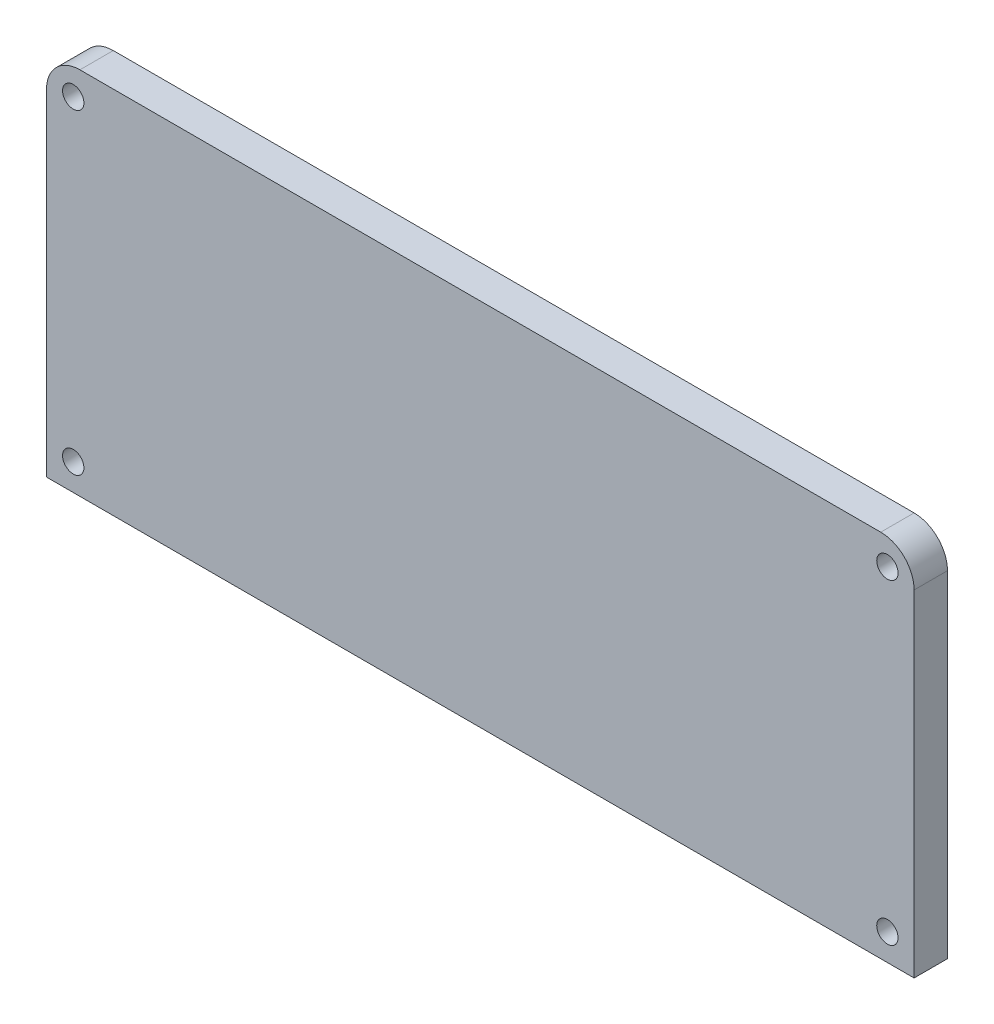
from build123d import *

# Parameters (mm, degrees)
BOSS_EXTRUDE1_DEPTH                                 = 130
SHELL1_T                                            = -5
SKETCH3_R                                           = 3.4
SKETCH3_W                                           = 73.1
SKETCH3_H                                           = 26.5
CUT_EXTRUDE1_DEPTH                                  = 5
FILLET1_R                                           = 10
FILLET2_R                                           = 5
CUT_EXTRUDE2_DEPTH                                  = 5
FILLET3_R                                           = 5
CUT_EXTRUDE3_REACH                                  = 191.36
SKETCH5_R                                           = 1.4
CUT_EXTRUDE4_REACH                                  = 191.36
SKETCH6_R                                           = 1.1
CUT_EXTRUDE5_REACH                                  = 185.945
SKETCH7_R                                           = 1.5
CSK_FOR_M3_COUNTERSUNK_FLAT_HEAD_SCREW2_D           = 3.2
CSK_FOR_M3_COUNTERSUNK_FLAT_HEAD_SCREW2_DEPTH       = 8
CSK_FOR_M3_COUNTERSUNK_FLAT_HEAD_SCREW2_CSINK_D     = 6.3
CSK_FOR_M3_COUNTERSUNK_FLAT_HEAD_SCREW2_CSINK_ANGLE = 90
CSK_FOR_M3_COUNTERSUNK_FLAT_HEAD_SCREW2_TIP         = 0.96137699
CUT_EXTRUDE6_REACH                                  = 187.376
SKETCH15_R                                          = 1.2
CUT_EXTRUDE7_DEPTH                                  = 20
SKETCH16_R                                          = 1.2
BOSS_EXTRUDE2_DEPTH                                 = 5
CSK_FOR_M3_COUNTERSUNK_FLAT_HEAD_SCR_2_COUNT        = 2
CSK_FOR_M3_COUNTERSUNK_FLAT_HEAD_SCR_2_PITCH        = 47.355339059
CSK_FOR_M3_COUNTERSUNK_FLAT_HEAD_SCR_3_COUNT        = 2
CSK_FOR_M3_COUNTERSUNK_FLAT_HEAD_SCR_3_PITCH        = 122
CSK_FOR_M3_COUNTERSUNK_FLAT_HEAD_SCR_4_COUNT        = 2
CSK_FOR_M3_COUNTERSUNK_FLAT_HEAD_SCR_4_PITCH        = 130.868361866


with BuildPart() as part:
    # Sketch2 → Boss-Extrude1 (new body)
    with BuildSketch(Plane(origin=(0, 0, 0), x_dir=(0, 0, -1), z_dir=(1, 0, 0))):
        Polygon((0, 0), (0, 20), (35.355339059, 55.355339059), (120, 55.355339059), (120, 0), align=None)
    extrude(amount=BOSS_EXTRUDE1_DEPTH)

    # Shell1
    shell1_openings = [part.faces().sort_by_distance(p)[0] for p in [
        (65, 27.67766953, -120),
    ]]
    offset(amount=SHELL1_T, openings=shell1_openings, kind=Kind.INTERSECTION)

    # Sketch3 → Cut-Extrude1 (cut)
    with BuildSketch(Plane(origin=(0, 10, 10), x_dir=(1, 0, 0), z_dir=(0, 0.7071067811865486, 0.7071067811865465))):
        with Locations(Location((108.1, 39.142135624, 0), (0, 0, 270))):
            Circle(SKETCH3_R)
        with Locations((53.55, 39.142135624)):
            Rectangle(SKETCH3_W, SKETCH3_H)
    extrude(amount=-CUT_EXTRUDE1_DEPTH, mode=Mode.SUBTRACT)

    # Fillet1
    # the kernel refuses this fillet: 10 mm, written as the material it adds along each edge
    with BuildSketch(Plane(origin=(125, 50.355339059, -37.426406871), x_dir=(0, 0, -1), z_dir=(-1, 0, 0)), Plane(origin=(125, 17.928932188, -5), x_dir=(0, 0.7071067811865465, -0.7071067811865486), z_dir=(-1, 0, 0))) as fillet1_piece_1:
        with BuildLine():
            CenterArc((FILLET1_R * 0.414213562373, FILLET1_R), FILLET1_R, 225, 45)
            Line((-FILLET1_R * 0.292893218813, FILLET1_R * 0.292893218813), (0, 0))
            Line((0, 0), (FILLET1_R * 0.414213562373, 0))
        make_face()
    extrude(amount=120)
    with BuildSketch(Plane(origin=(5, 5, -5), x_dir=(0, 0, -1), z_dir=(1, 0, 0))) as fillet1_piece_2:
        with BuildLine():
            CenterArc((FILLET1_R, FILLET1_R), FILLET1_R, 180, 90)
            Line((0, FILLET1_R), (0, 0))
            Line((0, 0), (FILLET1_R, 0))
        make_face()
    extrude(amount=120)
    # the kernel refuses this fillet: 10 mm, written as the material it takes off along each edge
    with BuildSketch(Plane(origin=(-10.355339059, 20, 0), x_dir=(0, -1, 0), z_dir=(1, 0, 0)), Plane(origin=(-10.355339059, 55.355339059, -35.355339059), x_dir=(0, -0.7071067811865476, 0.7071067811865476), z_dir=(1, 0, 0))) as fillet1_2_piece_1:
        with BuildLine():
            CenterArc((FILLET1_R * 0.414213562373, FILLET1_R), FILLET1_R, 225, 45)
            Line((-FILLET1_R * 0.292893218813, FILLET1_R * 0.292893218813), (0, 0))
            Line((0, 0), (FILLET1_R * 0.414213562373, 0))
        make_face()
    extrude(amount=150.710678119, mode=Mode.SUBTRACT)

    # Fillet2
    fillet2_edges = [part.edges().sort_by_distance(p)[0] for p in [
        (130, 55.355339059, -79.748737342),
        (0, 7.928932188, 0),
        (130, 7.928932188, 0),
        (0, 37.67766953, -17.67766953),
        (0, 54.594134384, -35.670640359),
        (0, 19.6846987, -0.761204675),
        (130, 37.67766953, -17.67766953),
        (130, 54.594134384, -35.670640359),
        (130, 19.6846987, -0.761204675),
        (0, 55.355339059, -79.748737342),
    ]]
    fillet(fillet2_edges, radius=FILLET2_R)

    # Sketch4 → Cut-Extrude2 (cut)
    with BuildSketch(Plane(origin=(130, 0, 0), x_dir=(0, 0, -1), z_dir=(1, 0, 0))):
        with BuildLine():
            Line((108, 22), (112, 22))
            ThreePointArc((112, 22), (113.414213562, 21.414213562), (114, 20))
            Line((114, 20), (114, 17))
            ThreePointArc((114, 17), (113.414213562, 15.585786438), (112, 15))
            Line((112, 15), (108, 15))
            ThreePointArc((108, 15), (106.585786438, 15.585786438), (106, 17))
            Line((106, 17), (106, 20))
            ThreePointArc((106, 20), (106.585786438, 21.414213562), (108, 22))
        make_face()
    extrude(amount=-CUT_EXTRUDE2_DEPTH, mode=Mode.SUBTRACT)

    # Fillet3
    # the kernel refuses this fillet: 5 mm, written as the material it adds along each edge
    with BuildSketch(Plane(origin=(5, 50.355339059, -120), x_dir=(1, 0, 0), z_dir=(0, 0, 1))) as fillet3_piece_1:
        with BuildLine():
            CenterArc((FILLET3_R, -FILLET3_R), FILLET3_R, 90, 90)
            Line((0, -FILLET3_R), (0, 0))
            Line((0, 0), (FILLET3_R, 0))
        make_face()
    fillet3_piece_1_solid = extrude(amount=78.431457505, mode=Mode.PRIVATE)
    with BuildSketch(Plane(origin=(125, 50.355339059, -120), x_dir=(-1, 0, 0), z_dir=(0, 0, 1))) as fillet3_piece_2:
        with BuildLine():
            CenterArc((FILLET3_R, FILLET3_R), FILLET3_R, 180, 90)
            Line((0, FILLET3_R), (0, 0))
            Line((0, 0), (FILLET3_R, 0))
        make_face()
    fillet3_piece_2_solid = extrude(amount=78.431457505, mode=Mode.PRIVATE)
    with BuildSketch(Plane(origin=(5, 5, -15), x_dir=(0, 1, 0), z_dir=(0, 0, -1)), Plane(origin=(125, 5, -15), x_dir=(-1, 0, 0), z_dir=(0, 0, -1))) as fillet3_piece_3:
        with BuildLine():
            CenterArc((FILLET3_R, FILLET3_R), FILLET3_R, 180, 90)
            Line((0, FILLET3_R), (0, 0))
            Line((0, 0), (FILLET3_R, 0))
        make_face()
    fillet3_piece_3_solid = extrude(amount=105, mode=Mode.PRIVATE)
    with BuildSketch(Plane(origin=(5, 47.426406871, -34.497474683), x_dir=(0, -0.7071067811865487, -0.7071067811865464), z_dir=(0, -0.7071067811865465, 0.7071067811865487))) as fillet3_piece_4:
        with BuildLine():
            CenterArc((FILLET3_R, FILLET3_R), FILLET3_R, 180, 90)
            Line((0, FILLET3_R), (0, 0))
            Line((0, 0), (FILLET3_R, 0))
        make_face()
    fillet3_piece_4_solid = extrude(amount=37.573593129, mode=Mode.PRIVATE)
    with BuildSketch(Plane(origin=(5, 13.786796564, -15), x_dir=(0, -0.9281493111658919, 0.3722080818336436), z_dir=(0, -0.3722080818336436, -0.9281493111658919))) as fillet3_piece_5:
        with BuildLine():
            CenterArc((10 - FILLET3_R, -FILLET3_R), FILLET3_R, 0, 90)
            Line((10, -FILLET3_R), (10, 0))
            Line((10, 0), (10 - FILLET3_R, 0))
        make_face()
    fillet3_piece_5_solid = revolve(axis=Axis((5, 13.786796564, -15), (-1, 0, 0)), revolution_arc=113.148139986, mode=Mode.PRIVATE)
    with BuildSketch(Plane(origin=(5, 15, -15), x_dir=(0, 0.9282822091618541, 0.37187651196813665), z_dir=(0, 0.37187651196813665, -0.9282822091618541))) as fillet3_piece_6:
        with BuildLine():
            CenterArc((10 - FILLET3_R, FILLET3_R), FILLET3_R, 270, 90)
            Line((10, FILLET3_R), (10, 0))
            Line((10, 0), (10 - FILLET3_R, 0))
        make_face()
    fillet3_piece_6_solid = revolve(axis=Axis((5, 15, -15), (1, 0, 0)), revolution_arc=158.168606729, mode=Mode.PRIVATE)
    with BuildSketch(Plane(origin=(5, 40.355339059, -41.568542495), x_dir=(0, 0.7071067811865476, 0.7071067811865476), z_dir=(0, -0.7071067811865476, 0.7071067811865476))) as fillet3_piece_7:
        with BuildLine():
            CenterArc((10 - FILLET3_R, -FILLET3_R), FILLET3_R, 0, 90)
            Line((10, -FILLET3_R), (10, 0))
            Line((10, 0), (10 - FILLET3_R, 0))
        make_face()
    fillet3_piece_7_solid = revolve(axis=Axis((5, 40.355339059, -41.568542495), (-1, 0, 0)), revolution_arc=45, mode=Mode.PRIVATE)
    with BuildSketch(Plane(origin=(125, 47.426406871, -34.497474683), x_dir=(-2.842170943040401e-15, -0.7071067811865487, -0.7071067811865464), z_dir=(0, -0.7071067811865465, 0.7071067811865487))) as fillet3_piece_8:
        with BuildLine():
            CenterArc((FILLET3_R, -FILLET3_R), FILLET3_R, 90, 90)
            Line((0, -FILLET3_R), (0, 0))
            Line((0, 0), (FILLET3_R, 0))
        make_face()
    fillet3_piece_8_solid = extrude(amount=37.573593129, mode=Mode.PRIVATE)
    with BuildSketch(Plane(origin=(125, 13.786796564, -15), x_dir=(0, -0.9281493111658919, 0.3722080818336436), z_dir=(0, -0.3722080818336436, -0.9281493111658919))) as fillet3_piece_9:
        with BuildLine():
            CenterArc((10 - FILLET3_R, FILLET3_R), FILLET3_R, 270, 90)
            Line((10, FILLET3_R), (10, 0))
            Line((10, 0), (10 - FILLET3_R, 0))
        make_face()
    fillet3_piece_9_solid = revolve(axis=Axis((125, 13.786796564, -15), (-1, 0, 0)), revolution_arc=113.148139986, mode=Mode.PRIVATE)
    with BuildSketch(Plane(origin=(125, 15, -15), x_dir=(0, 0.9282822091618541, 0.37187651196813665), z_dir=(0, 0.37187651196813665, -0.9282822091618541))) as fillet3_piece_10:
        with BuildLine():
            CenterArc((10 - FILLET3_R, -FILLET3_R), FILLET3_R, 0, 90)
            Line((10, -FILLET3_R), (10, 0))
            Line((10, 0), (10 - FILLET3_R, 0))
        make_face()
    fillet3_piece_10_solid = revolve(axis=Axis((125, 15, -15), (1, 0, 0)), revolution_arc=158.168606729, mode=Mode.PRIVATE)
    with BuildSketch(Plane(origin=(125, 40.355339059, -41.568542495), x_dir=(0, 0.7071067811865476, 0.7071067811865476), z_dir=(0, -0.7071067811865476, 0.7071067811865476))) as fillet3_piece_11:
        with BuildLine():
            CenterArc((10 - FILLET3_R, FILLET3_R), FILLET3_R, 270, 90)
            Line((10, FILLET3_R), (10, 0))
            Line((10, 0), (10 - FILLET3_R, 0))
        make_face()
    fillet3_piece_11_solid = revolve(axis=Axis((125, 40.355339059, -41.568542495), (-1, 0, 0)), revolution_arc=45, mode=Mode.PRIVATE)
    add([fillet3_piece_1_solid, fillet3_piece_2_solid, fillet3_piece_3_solid, fillet3_piece_4_solid, fillet3_piece_5_solid, fillet3_piece_6_solid, fillet3_piece_7_solid, fillet3_piece_8_solid, fillet3_piece_9_solid, fillet3_piece_10_solid, fillet3_piece_11_solid])

    # Sketch5 → Cut-Extrude3 (cut, up to next)
    with BuildSketch(Plane(origin=(0, 10, 10), x_dir=(1, 0, 0), z_dir=(0, 0.7071067811865486, 0.7071067811865465)), mode=Mode.PRIVATE) as cut_extrude3_sk1:
        with Locations(Location((116.3, 48.442135624, 0), (0, 0, 270))):
            Circle(SKETCH5_R)
    cut_extrude3_tool1 = extrude(cut_extrude3_sk1.sketch, amount=-CUT_EXTRUDE3_REACH, mode=Mode.PRIVATE) & part.part
    # Sketch5 → Cut-Extrude3 (cut, up to next)
    with BuildSketch(Plane(origin=(0, 10, 10), x_dir=(1, 0, 0), z_dir=(0, 0.7071067811865486, 0.7071067811865465)), mode=Mode.PRIVATE) as cut_extrude3_sk2:
        with Locations(Location((116.3, 34.442135624, 0), (0, 0, 270))):
            Circle(SKETCH5_R)
    cut_extrude3_tool2 = extrude(cut_extrude3_sk2.sketch, amount=-CUT_EXTRUDE3_REACH, mode=Mode.PRIVATE) & part.part
    add(cut_extrude3_tool1.solids().sort_by_distance((116.3, 44.253763, -24.253763))[0], mode=Mode.SUBTRACT)
    add(cut_extrude3_tool2.solids().sort_by_distance((116.3, 34.354268, -14.354268))[0], mode=Mode.SUBTRACT)

    # Sketch6 → Cut-Extrude4 (cut, up to next)
    with BuildSketch(Plane(origin=(0, 10, 10), x_dir=(1, 0, 0), z_dir=(0, 0.7071067811865486, 0.7071067811865465)), mode=Mode.PRIVATE) as cut_extrude4_sk1:
        with Locations(Location((15.8, 54.392135624, 0), (0, 0, 270))):
            Circle(SKETCH6_R)
    cut_extrude4_tool1 = extrude(cut_extrude4_sk1.sketch, amount=-CUT_EXTRUDE4_REACH, mode=Mode.PRIVATE) & part.part
    # Sketch6 → Cut-Extrude4 (cut, up to next)
    with BuildSketch(Plane(origin=(0, 10, 10), x_dir=(1, 0, 0), z_dir=(0, 0.7071067811865486, 0.7071067811865465)), mode=Mode.PRIVATE) as cut_extrude4_sk2:
        with Locations(Location((90.8, 54.392135624, 0), (0, 0, 270))):
            Circle(SKETCH6_R)
    cut_extrude4_tool2 = extrude(cut_extrude4_sk2.sketch, amount=-CUT_EXTRUDE4_REACH, mode=Mode.PRIVATE) & part.part
    # Sketch6 → Cut-Extrude4 (cut, up to next)
    with BuildSketch(Plane(origin=(0, 10, 10), x_dir=(1, 0, 0), z_dir=(0, 0.7071067811865486, 0.7071067811865465)), mode=Mode.PRIVATE) as cut_extrude4_sk3:
        with Locations(Location((90.8, 23.392135624, 0), (0, 0, 270))):
            Circle(SKETCH6_R)
    cut_extrude4_tool3 = extrude(cut_extrude4_sk3.sketch, amount=-CUT_EXTRUDE4_REACH, mode=Mode.PRIVATE) & part.part
    # Sketch6 → Cut-Extrude4 (cut, up to next)
    with BuildSketch(Plane(origin=(0, 10, 10), x_dir=(1, 0, 0), z_dir=(0, 0.7071067811865486, 0.7071067811865465)), mode=Mode.PRIVATE) as cut_extrude4_sk4:
        with Locations(Location((15.8, 23.392135624, 0), (0, 0, 270))):
            Circle(SKETCH6_R)
    cut_extrude4_tool4 = extrude(cut_extrude4_sk4.sketch, amount=-CUT_EXTRUDE4_REACH, mode=Mode.PRIVATE) & part.part
    add(cut_extrude4_tool1.solids().sort_by_distance((15.8, 48.461048, -28.461048))[0], mode=Mode.SUBTRACT)
    add(cut_extrude4_tool2.solids().sort_by_distance((90.8, 48.461048, -28.461048))[0], mode=Mode.SUBTRACT)
    add(cut_extrude4_tool3.solids().sort_by_distance((90.8, 26.540738, -6.540738))[0], mode=Mode.SUBTRACT)
    add(cut_extrude4_tool4.solids().sort_by_distance((15.8, 26.540738, -6.540738))[0], mode=Mode.SUBTRACT)

    # Sketch7 → Cut-Extrude5 (cut, up to next)
    with BuildSketch(Plane(origin=(0, 5, 0), x_dir=(1, 0, 0), z_dir=(0, 1, 0)), mode=Mode.PRIVATE) as cut_extrude5_sk1:
        with Locations(Location((16.5, 21.5, 0), (0, 0, 270))):
            Circle(SKETCH7_R)
    cut_extrude5_tool1 = extrude(cut_extrude5_sk1.sketch, amount=-CUT_EXTRUDE5_REACH, mode=Mode.PRIVATE) & part.part
    # Sketch7 → Cut-Extrude5 (cut, up to next)
    with BuildSketch(Plane(origin=(0, 5, 0), x_dir=(1, 0, 0), z_dir=(0, 1, 0)), mode=Mode.PRIVATE) as cut_extrude5_sk2:
        with Locations(Location((16.5, 64.5, 0), (0, 0, 270))):
            Circle(SKETCH7_R)
    cut_extrude5_tool2 = extrude(cut_extrude5_sk2.sketch, amount=-CUT_EXTRUDE5_REACH, mode=Mode.PRIVATE) & part.part
    # Sketch7 → Cut-Extrude5 (cut, up to next)
    with BuildSketch(Plane(origin=(0, 5, 0), x_dir=(1, 0, 0), z_dir=(0, 1, 0)), mode=Mode.PRIVATE) as cut_extrude5_sk3:
        with Locations(Location((109.5, 21.5, 0), (0, 0, 270))):
            Circle(SKETCH7_R)
    cut_extrude5_tool3 = extrude(cut_extrude5_sk3.sketch, amount=-CUT_EXTRUDE5_REACH, mode=Mode.PRIVATE) & part.part
    # Sketch7 → Cut-Extrude5 (cut, up to next)
    with BuildSketch(Plane(origin=(0, 5, 0), x_dir=(1, 0, 0), z_dir=(0, 1, 0)), mode=Mode.PRIVATE) as cut_extrude5_sk4:
        with Locations(Location((109.5, 64.5, 0), (0, 0, 270))):
            Circle(SKETCH7_R)
    cut_extrude5_tool4 = extrude(cut_extrude5_sk4.sketch, amount=-CUT_EXTRUDE5_REACH, mode=Mode.PRIVATE) & part.part
    # Sketch7 → Cut-Extrude5 (cut, up to next)
    with BuildSketch(Plane(origin=(0, 5, 0), x_dir=(1, 0, 0), z_dir=(0, 1, 0)), mode=Mode.PRIVATE) as cut_extrude5_sk5:
        with Locations(Location((109, 79, 0), (0, 0, 270))):
            Circle(SKETCH7_R)
    cut_extrude5_tool5 = extrude(cut_extrude5_sk5.sketch, amount=-CUT_EXTRUDE5_REACH, mode=Mode.PRIVATE) & part.part
    # Sketch7 → Cut-Extrude5 (cut, up to next)
    with BuildSketch(Plane(origin=(0, 5, 0), x_dir=(1, 0, 0), z_dir=(0, 1, 0)), mode=Mode.PRIVATE) as cut_extrude5_sk6:
        with Locations(Location((53, 79, 0), (0, 0, 270))):
            Circle(SKETCH7_R)
    cut_extrude5_tool6 = extrude(cut_extrude5_sk6.sketch, amount=-CUT_EXTRUDE5_REACH, mode=Mode.PRIVATE) & part.part
    # Sketch7 → Cut-Extrude5 (cut, up to next)
    with BuildSketch(Plane(origin=(0, 5, 0), x_dir=(1, 0, 0), z_dir=(0, 1, 0)), mode=Mode.PRIVATE) as cut_extrude5_sk7:
        with Locations(Location((53, 115, 0), (0, 0, 270))):
            Circle(SKETCH7_R)
    cut_extrude5_tool7 = extrude(cut_extrude5_sk7.sketch, amount=-CUT_EXTRUDE5_REACH, mode=Mode.PRIVATE) & part.part
    # Sketch7 → Cut-Extrude5 (cut, up to next)
    with BuildSketch(Plane(origin=(0, 5, 0), x_dir=(1, 0, 0), z_dir=(0, 1, 0)), mode=Mode.PRIVATE) as cut_extrude5_sk8:
        with Locations(Location((109, 115, 0), (0, 0, 270))):
            Circle(SKETCH7_R)
    cut_extrude5_tool8 = extrude(cut_extrude5_sk8.sketch, amount=-CUT_EXTRUDE5_REACH, mode=Mode.PRIVATE) & part.part
    add(cut_extrude5_tool1.solids().sort_by_distance((16.5, 5, -21.5))[0], mode=Mode.SUBTRACT)
    add(cut_extrude5_tool2.solids().sort_by_distance((16.5, 5, -64.5))[0], mode=Mode.SUBTRACT)
    add(cut_extrude5_tool3.solids().sort_by_distance((109.5, 5, -21.5))[0], mode=Mode.SUBTRACT)
    add(cut_extrude5_tool4.solids().sort_by_distance((109.5, 5, -64.5))[0], mode=Mode.SUBTRACT)
    add(cut_extrude5_tool5.solids().sort_by_distance((109, 5, -79))[0], mode=Mode.SUBTRACT)
    add(cut_extrude5_tool6.solids().sort_by_distance((53, 5, -79))[0], mode=Mode.SUBTRACT)
    add(cut_extrude5_tool7.solids().sort_by_distance((53, 5, -115))[0], mode=Mode.SUBTRACT)
    add(cut_extrude5_tool8.solids().sort_by_distance((109, 5, -115))[0], mode=Mode.SUBTRACT)

    # CSK for M3 Countersunk Flat Head Screw2
    with Locations(Plane(origin=(0, 0, 0), x_dir=(-1, 0, 0), z_dir=(0, -1, 0))):
        with Locations((-109, 115), (-53, 115), (-53, 79), (-109, 79), (-16.5, 64.5), (-16.5, 21.5), (-109.5, 21.5), (-109.5, 64.5)):
            CounterSinkHole(CSK_FOR_M3_COUNTERSUNK_FLAT_HEAD_SCREW2_D / 2, CSK_FOR_M3_COUNTERSUNK_FLAT_HEAD_SCREW2_CSINK_D / 2, depth=CSK_FOR_M3_COUNTERSUNK_FLAT_HEAD_SCREW2_DEPTH, counter_sink_angle=CSK_FOR_M3_COUNTERSUNK_FLAT_HEAD_SCREW2_CSINK_ANGLE)
            with Locations((0, 0, -(CSK_FOR_M3_COUNTERSUNK_FLAT_HEAD_SCREW2_DEPTH + CSK_FOR_M3_COUNTERSUNK_FLAT_HEAD_SCREW2_TIP / 2))):  # 118° drill point
                Cone(0, CSK_FOR_M3_COUNTERSUNK_FLAT_HEAD_SCREW2_D / 2, CSK_FOR_M3_COUNTERSUNK_FLAT_HEAD_SCREW2_TIP, mode=Mode.SUBTRACT)

    # Sketch14 → Cut-Extrude6 (cut, up to next)
    with BuildSketch(Plane.ZY, mode=Mode.PRIVATE) as cut_extrude6_sk1:
        with BuildLine():
            Line((-34, 18.5), (-30, 18.5))
            ThreePointArc((-30, 18.5), (-26, 14.5), (-30, 10.5))
            Line((-30, 10.5), (-34, 10.5))
            ThreePointArc((-34, 10.5), (-38, 14.5), (-34, 18.5))
        make_face()
    cut_extrude6_tool1 = extrude(cut_extrude6_sk1.sketch, amount=-CUT_EXTRUDE6_REACH, mode=Mode.PRIVATE) & part.part
    add(cut_extrude6_tool1.solids().sort_by_distance((0, 14.5, -32))[0], mode=Mode.SUBTRACT)

    # Sketch15 → Cut-Extrude7 (cut)
    with BuildSketch(Plane(origin=(0, 0, -120), x_dir=(-1, 0, 0), z_dir=(0, 0, -1))):
        with Locations((-126, 51.355339059)):
            Circle(SKETCH15_R)
        with Locations((-126, 4)):
            Circle(SKETCH15_R)
        with Locations((-4, 4)):
            Circle(SKETCH15_R)
        with Locations((-4, 51.355339059)):
            Circle(SKETCH15_R)
    extrude(amount=-CUT_EXTRUDE7_DEPTH, mode=Mode.SUBTRACT)


with BuildPart() as body_2:
    # Sketch16 → Boss-Extrude2 (new body)
    with BuildSketch(Plane(origin=(0, 0, -120), x_dir=(-1, 0, 0), z_dir=(0, 0, -1))):
        with BuildLine():
            Line((0, 0), (0, 50.355339059))
            ThreePointArc((0, 50.355339059), (-1.464466094, 53.890872965), (-5, 55.355339059))
            Line((-5, 55.355339059), (-125, 55.355339059))
            ThreePointArc((-125, 55.355339059), (-128.535533906, 53.890872965), (-130, 50.355339059))
            Line((-130, 50.355339059), (-130, 0))
            Line((-130, 0), (0, 0))
        make_face()
        with Locations((-126, 4)):
            Circle(SKETCH16_R, mode=Mode.SUBTRACT)
        with Locations((-4, 4)):
            Circle(SKETCH16_R, mode=Mode.SUBTRACT)
        with Locations((-4, 51.355339059)):
            Circle(SKETCH16_R, mode=Mode.SUBTRACT)
        with Locations((-126, 51.355339059)):
            Circle(SKETCH16_R, mode=Mode.SUBTRACT)
    extrude(amount=BOSS_EXTRUDE2_DEPTH)

    # Sketch20 → CSK for M3 Countersunk Flat Head Screw3 (revolve, cut)
    with BuildSketch(Plane(origin=(126, 51.355339059, -125), x_dir=(0, 1, 0), z_dir=(1, 0, 0))):
        Polygon((0, 0), (0, 8.96137699), (1.6, 8), (1.6, 1.55), (3.15, 0), align=None)
    csk_for_m3_countersunk_flat_head_screw3 = revolve(axis=Axis((126, 51.355339059, -131.35), (0, 0, 1)), mode=Mode.SUBTRACT)

    # CSK for M3 Countersunk Flat Head Scr 2: CSK for M3 Countersunk Flat Head Screw3 ×2
    with Locations(*[(0, -i * CSK_FOR_M3_COUNTERSUNK_FLAT_HEAD_SCR_2_PITCH, 0) for i in range(1, CSK_FOR_M3_COUNTERSUNK_FLAT_HEAD_SCR_2_COUNT)]):
        add(csk_for_m3_countersunk_flat_head_screw3, mode=Mode.SUBTRACT)

    # CSK for M3 Countersunk Flat Head Scr 3: CSK for M3 Countersunk Flat Head Screw3 ×2
    with Locations(*[(-i * CSK_FOR_M3_COUNTERSUNK_FLAT_HEAD_SCR_3_PITCH, 0, 0) for i in range(1, CSK_FOR_M3_COUNTERSUNK_FLAT_HEAD_SCR_3_COUNT)]):
        add(csk_for_m3_countersunk_flat_head_screw3, mode=Mode.SUBTRACT)

    # CSK for M3 Countersunk Flat Head Scr 4: CSK for M3 Countersunk Flat Head Screw3 ×2
    with Locations(*[Vector(-0.9322344855600483, -0.3618547552991284, 0) * (i * CSK_FOR_M3_COUNTERSUNK_FLAT_HEAD_SCR_4_PITCH) for i in range(1, CSK_FOR_M3_COUNTERSUNK_FLAT_HEAD_SCR_4_COUNT)]):
        add(csk_for_m3_countersunk_flat_head_screw3, mode=Mode.SUBTRACT)


solid = body_2.part
